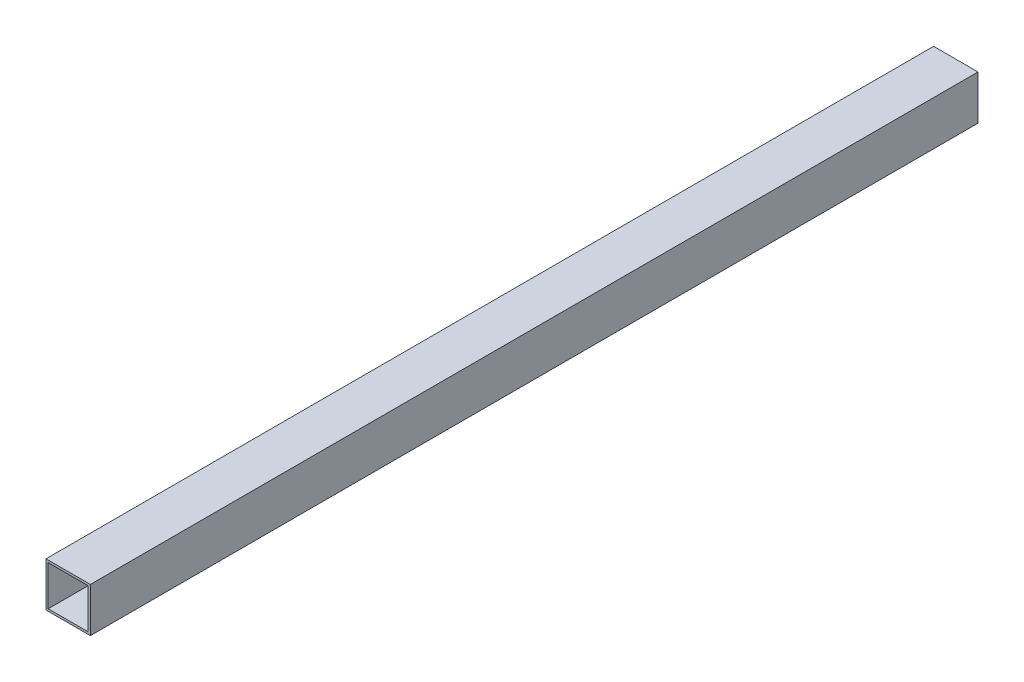
from build123d import *

# Parameters (mm, degrees)
SKETCH_1_W      = 20
SKETCH_1_H      = 20
SKETCH_1_W_2    = 18
SKETCH_1_H_2    = 18
EXTRUDE_1_DEPTH = 400


with BuildPart() as part:
    # 草图1 → 拉伸-薄壁1 (new body)
    with BuildSketch(Plane.XY):
        with Locations((10, -10)):
            Rectangle(SKETCH_1_W, SKETCH_1_H)
        with Locations((10, -10)):
            Rectangle(SKETCH_1_W_2, SKETCH_1_H_2, mode=Mode.SUBTRACT)
    extrude(amount=EXTRUDE_1_DEPTH)


solid = part.part
